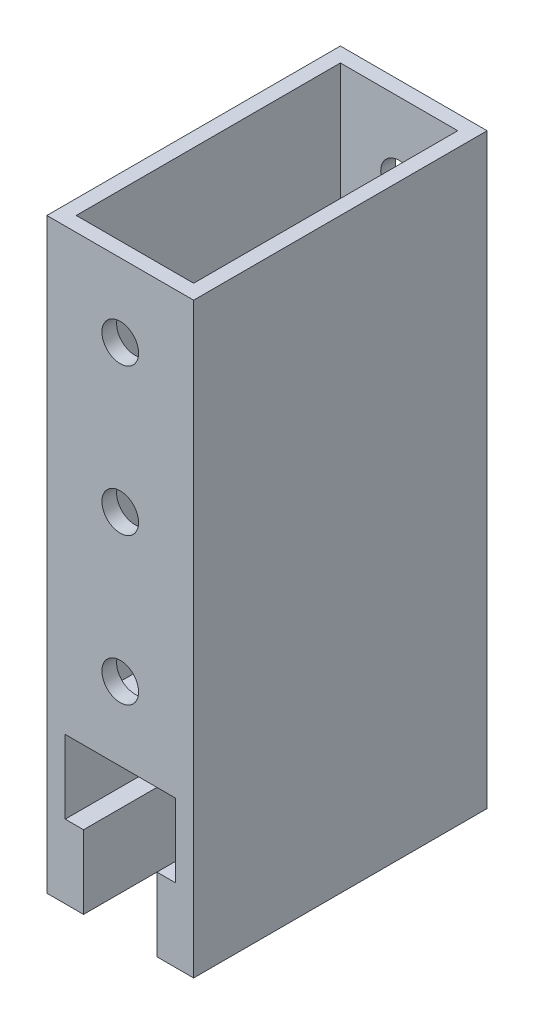
from build123d import *

# Parameters (mm, degrees)
SKETCH1_W           = 25.4
SKETCH1_H           = 101.6
BOSS_EXTRUDE1_DEPTH = 25.4
SKETCH2_R           = 3.175
CUT_EXTRUDE1_DEPTH  = 117.397422652
SKETCH3_W           = 20.32
SKETCH3_H           = 45.72
CUT_EXTRUDE2_DEPTH  = 73.66
CUT_EXTRUDE4_DEPTH  = 117.397422652


with BuildPart() as part:
    # Sketch1 → Boss-Extrude1 (new, symmetric)
    with BuildSketch(Plane.XY):
        with Locations((12.7, 50.8)):
            Rectangle(SKETCH1_W, SKETCH1_H)
    extrude(amount=BOSS_EXTRUDE1_DEPTH, both=True)

    # Sketch2 → Cut-Extrude1 (cut, through all)
    with BuildSketch(Plane.XY.offset(25.4)):
        with Locations((12.7, 38.1)):
            Circle(SKETCH2_R)
        with Locations((12.7, 63.5)):
            Circle(SKETCH2_R)
        with Locations((12.7, 88.9)):
            Circle(SKETCH2_R)
    extrude(amount=-CUT_EXTRUDE1_DEPTH, mode=Mode.SUBTRACT)

    # Sketch3 → Cut-Extrude2 (cut)
    with BuildSketch(Plane(origin=(0, 101.6, 0), x_dir=(1, 0, 0), z_dir=(0, 1, 0))):
        with Locations((12.7, 0)):
            Rectangle(SKETCH3_W, SKETCH3_H)
    extrude(amount=-CUT_EXTRUDE2_DEPTH, mode=Mode.SUBTRACT)

    # Sketch5 → Cut-Extrude4 (cut, through all)
    with BuildSketch(Plane.XY.offset(25.4)):
        Polygon((6.35, 0), (6.35, 12.7), (3.175, 12.7), (3.175, 25.4), (22.225, 25.4), (22.225, 12.7), (19.05, 12.7), (19.05, 0), align=None)
    extrude(amount=-CUT_EXTRUDE4_DEPTH, mode=Mode.SUBTRACT)


solid = part.part
